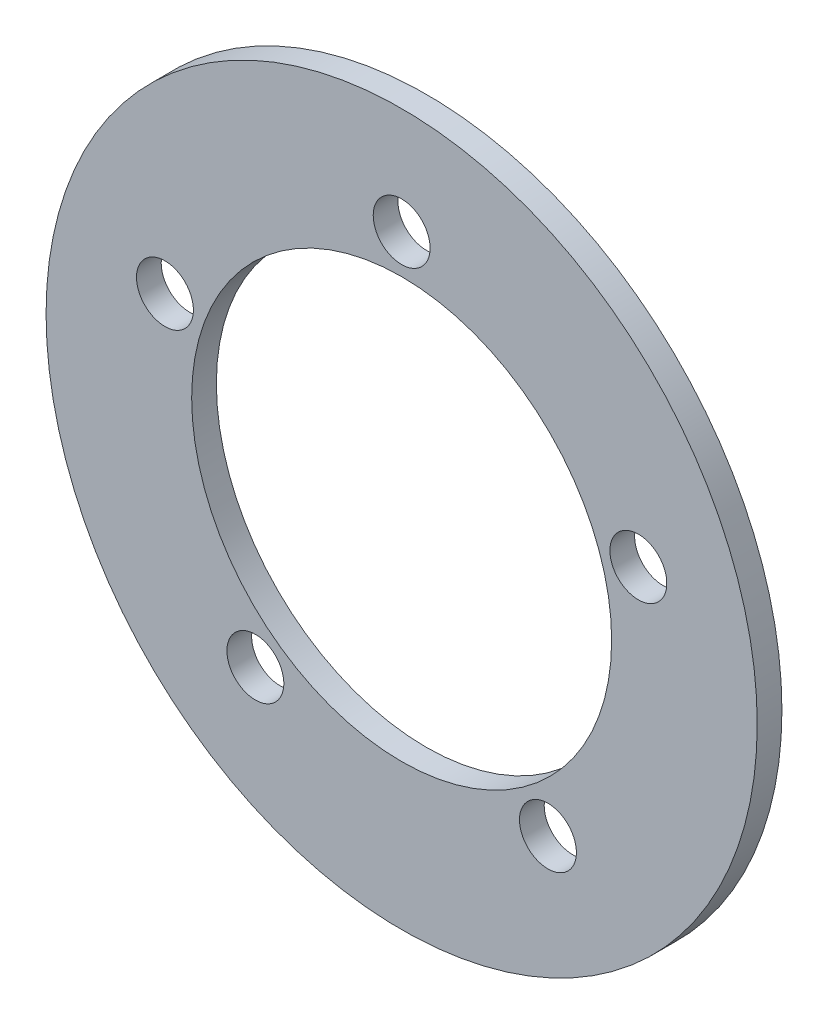
from build123d import *

# Parameters (mm, degrees)
SKETCH1_R           = 22.86
SKETCH1_R_2         = 13.5
SKETCH1_R_3         = 1.8288
BOSS_EXTRUDE1_DEPTH = 1.5875


with BuildPart() as part:
    # Sketch1 → Boss-Extrude1 (new body)
    with BuildSketch(Plane(origin=(0, 0, -15.24), x_dir=(-1, 0, 0), z_dir=(0, 0, -1))):
        Circle(SKETCH1_R)
        Circle(SKETCH1_R_2, mode=Mode.SUBTRACT)
        with Locations((15.216904261, 4.94427191)):
            Circle(SKETCH1_R_3, mode=Mode.SUBTRACT)
        with Locations((9.404564037, -12.94427191)):
            Circle(SKETCH1_R_3, mode=Mode.SUBTRACT)
        with Locations((-9.404564037, -12.94427191)):
            Circle(SKETCH1_R_3, mode=Mode.SUBTRACT)
        with Locations((-15.216904261, 4.94427191)):
            Circle(SKETCH1_R_3, mode=Mode.SUBTRACT)
        with Locations((0, 16)):
            Circle(SKETCH1_R_3, mode=Mode.SUBTRACT)
    extrude(amount=BOSS_EXTRUDE1_DEPTH)


solid = part.part
